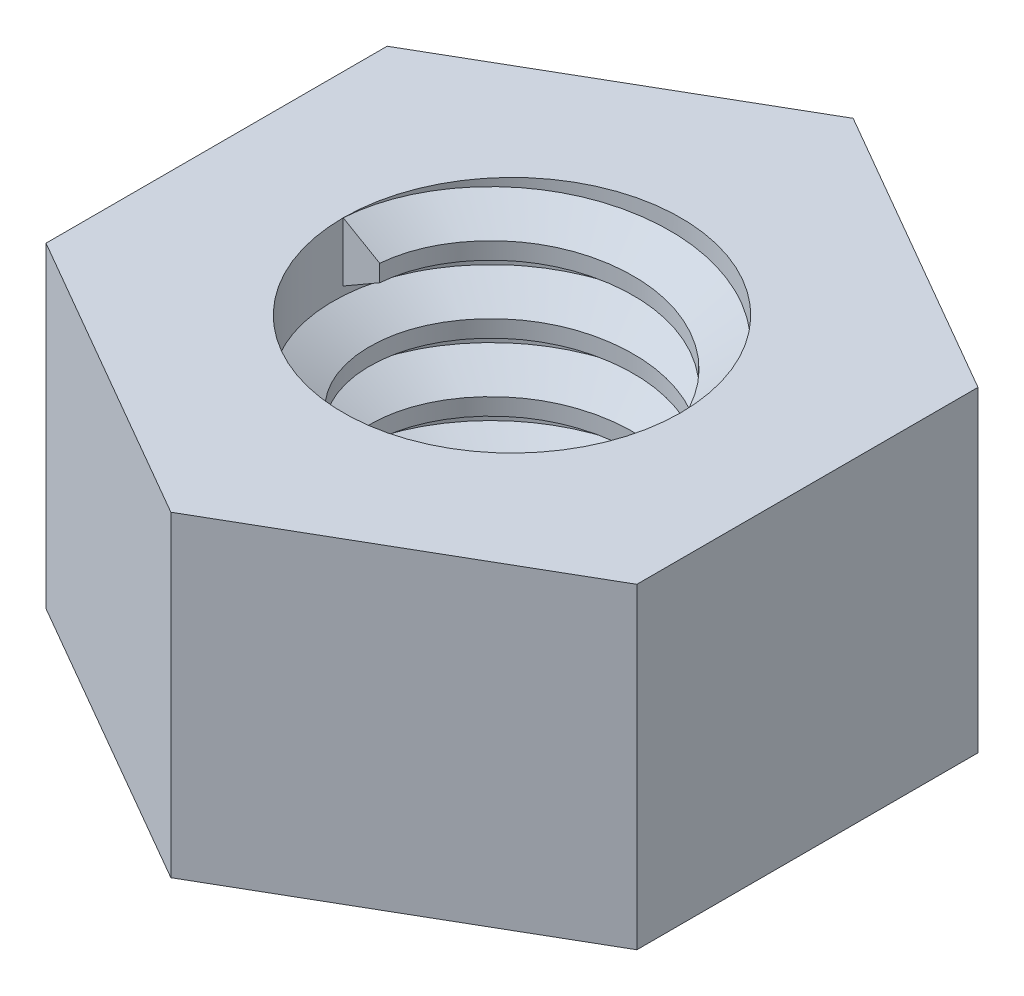
from build123d import *

# Parameters (mm, degrees)
SKETCH1_R           = 3.175
BOSS_EXTRUDE1_DEPTH = 5.953125
THREAD1_PITCH       = 1.27


with BuildPart() as part:
    # Sketch1 → Boss-Extrude1 (new body)
    with BuildSketch(Plane(origin=(0, 0, 0), x_dir=(1, 0, 0), z_dir=(0, 1, 0))):
        Polygon((0, 6.415804866), (-5.55625, 3.207902433), (-5.55625, -3.207902433), (0, -6.415804866), (5.55625, -3.207902433), (5.55625, 3.207902433), align=None)
        with Locations(Location((0, 0, 0), (0, 0, 270))):
            Circle(SKETCH1_R, mode=Mode.SUBTRACT)
    extrude(amount=BOSS_EXTRUDE1_DEPTH)

    # Thread1: the profile of Thread Profile1 profile screwed along a right-hand helix of 4.6875 turns, 8 arcs to a turn; built about Z, then put on its axis
    thread1_z = Axis((0, 0, 0), (0, 0, 1))
    thread1_corners = [(3.1753, 0, -0.000173205), (3.1753, 0, 1.111423202), (2.487592339, 0, 0.714374998), (2.487592339, 0, 0.396874998)]
    with BuildLine(mode=Mode.PRIVATE) as thread1_profile:
        Line(thread1_corners[0], thread1_corners[1])
        Line(thread1_corners[1], thread1_corners[2])
        Line(thread1_corners[2], thread1_corners[3])
        Line(thread1_corners[3], thread1_corners[0])
    thread1_cap = Face(thread1_profile.wire())
    thread1_turn_angles = [0, 22.5, 45, 67.5, 90, 112.5, 135, 157.5, 180, 202.5, 225, 247.5, 270, 292.5, 315, 337.5, 360]
    thread1_turn_weights = [1, 0.9238795325112867, 1, 0.9238795325112867, 1, 0.9238795325112867, 1, 0.9238795325112867, 1, 0.9238795325112867, 1, 0.9238795325112867, 1, 0.9238795325112867, 1, 0.9238795325112867, 1]
    thread1_turn_rails = [Edge.make_bspline([Vector(p[0], p[1], 0).rotate(thread1_z, thread1_turn_angles[k]) / thread1_turn_weights[k] + Vector(0, 0, p[2] + THREAD1_PITCH * thread1_turn_angles[k] / 360) for k in range(17)], [0, 0, 0, 1, 1, 2, 2, 3, 3, 4, 4, 5, 5, 6, 6, 7, 7, 8, 8, 8], 2, thread1_turn_weights) for p in thread1_corners]
    thread1_turn_sides = [Face.make_surface_from_curves(thread1_turn_rails[p[0]], thread1_turn_rails[p[1]]) for p in [(0, 1), (1, 2), (2, 3), (3, 0)]]
    thread1_last_angles = [1440, 1462.5, 1485, 1507.5, 1530, 1552.5, 1575, 1597.5, 1620, 1642.5, 1665, 1676.25, 1687.5]
    thread1_last_weights = [1, 0.9238795325112867, 1, 0.9238795325112867, 1, 0.9238795325112867, 1, 0.9238795325112867, 1, 0.9238795325112867, 1, 0.9807852804032304, 1]
    thread1_last_rails = [Edge.make_bspline([Vector(p[0], p[1], 0).rotate(thread1_z, thread1_last_angles[k]) / thread1_last_weights[k] + Vector(0, 0, p[2] + THREAD1_PITCH * thread1_last_angles[k] / 360) for k in range(13)], [0, 0, 0, 1, 1, 2, 2, 3, 3, 4, 4, 5, 5, 6, 6, 6], 2, thread1_last_weights) for p in thread1_corners]
    thread1_last_sides = [Face.make_surface_from_curves(thread1_last_rails[p[0]], thread1_last_rails[p[1]]) for p in [(0, 1), (1, 2), (2, 3), (3, 0)]]
    thread1 = Plane(origin=(0, 5.953125, 0), x_dir=(-1, 0, 0), z_dir=(0, -1, 0)) * Solid(Shell([*[p.moved(Location((0, 0, THREAD1_PITCH * i))) for i in range(4) for p in thread1_turn_sides], *thread1_last_sides, thread1_cap, thread1_cap.rotate(thread1_z, 1687.5).moved(Location((0, 0, THREAD1_PITCH * 1687.5 / 360)))]))
    add(thread1)


solid = part.part
